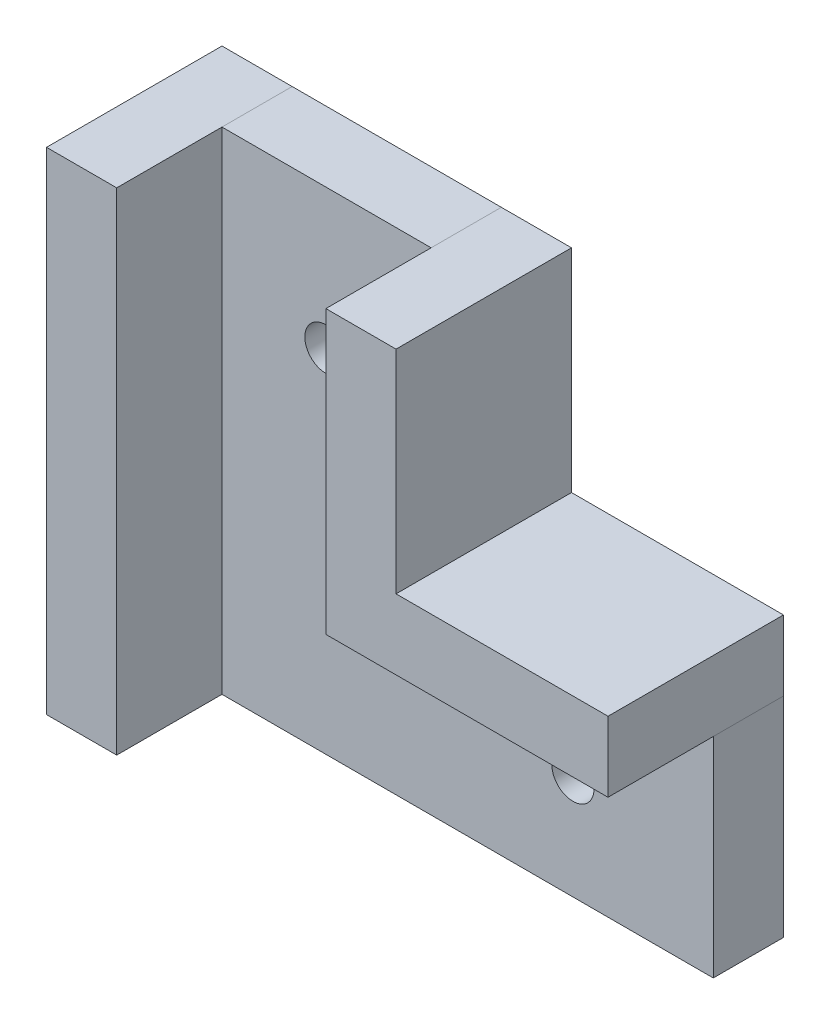
from build123d import *

# Parameters (mm, degrees)
BOSS_EXTRUDE1_DEPTH = 5
BOSS_EXTRUDE2_DEPTH = 12.5
SKETCH3_W           = 5
SKETCH3_H           = 35
BOSS_EXTRUDE3_DEPTH = 12.5
SKETCH4_R           = 1.5
CUT_EXTRUDE1_DEPTH  = 40.709532791


with BuildPart() as part:
    # Sketch1 → Boss-Extrude1 (new body)
    with BuildSketch(Plane.XY):
        Polygon((-7.529880478, -25.806772908), (27.470119522, -25.806772908), (27.470119522, -10.906772908), (7.370119522, -10.906772908), (7.370119522, 9.193227092), (-7.529880478, 9.193227092), align=None)
    extrude(amount=BOSS_EXTRUDE1_DEPTH)

    # Sketch4 → Cut-Extrude1 (cut, through all)
    with BuildSketch(Plane(origin=(0, 0, 0), x_dir=(-1, 0, 0), z_dir=(0, 0, -1))):
        with Locations((0.129880478, -0.806772908)):
            Circle(SKETCH4_R)
        with Locations((-17.470119522, -18.406772908)):
            Circle(SKETCH4_R)
    extrude(amount=-CUT_EXTRUDE1_DEPTH, mode=Mode.SUBTRACT)


with BuildPart() as body_2:
    # Sketch2 → Boss-Extrude2 (new body)
    with BuildSketch(Plane(origin=(0, 0, 0), x_dir=(-1, 0, 0), z_dir=(0, 0, -1))):
        Polygon((-7.370119522, 9.193227092), (-12.370119522, 9.193227092), (-12.370119522, -5.906772908), (-27.470119522, -5.906772908), (-27.470119522, -10.906772908), (-7.370119522, -10.906772908), align=None)
    extrude(amount=-BOSS_EXTRUDE2_DEPTH)


with BuildPart() as body_3:
    # Sketch3 → Boss-Extrude3 (new body)
    with BuildSketch(Plane(origin=(0, 0, 0), x_dir=(-1, 0, 0), z_dir=(0, 0, -1))):
        with Locations((10.029880478, -8.306772908)):
            Rectangle(SKETCH3_W, SKETCH3_H)
    extrude(amount=-BOSS_EXTRUDE3_DEPTH)


solid = Compound([part.part, body_2.part, body_3.part])
